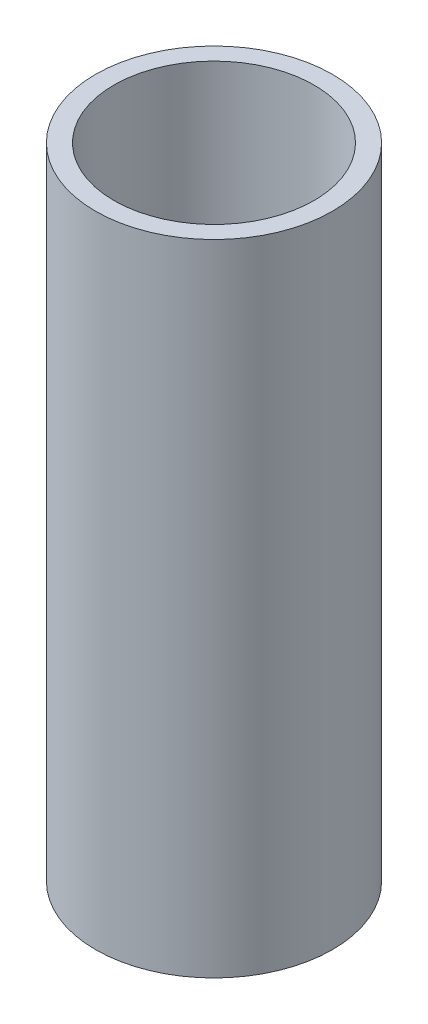
from build123d import *

# Parameters (mm, degrees)
SKETCH1_R           = 25
BOSS_EXTRUDE1_DEPTH = 134.893810304
SKETCH2_R           = 21.110135146
CUT_EXTRUDE1_DEPTH  = 140.450134666


with BuildPart() as part:
    # Sketch1 → Boss-Extrude1 (new body)
    with BuildSketch(Plane(origin=(0, 0, 0), x_dir=(1, 0, 0), z_dir=(0, 1, 0))):
        Circle(SKETCH1_R)
    extrude(amount=BOSS_EXTRUDE1_DEPTH)

    # Sketch2 → Cut-Extrude1 (cut, through all)
    with BuildSketch(Plane(origin=(0, 0, 0), x_dir=(1, 0, 0), z_dir=(0, 1, 0))):
        Circle(SKETCH2_R)
    extrude(amount=CUT_EXTRUDE1_DEPTH, mode=Mode.SUBTRACT)


solid = part.part
